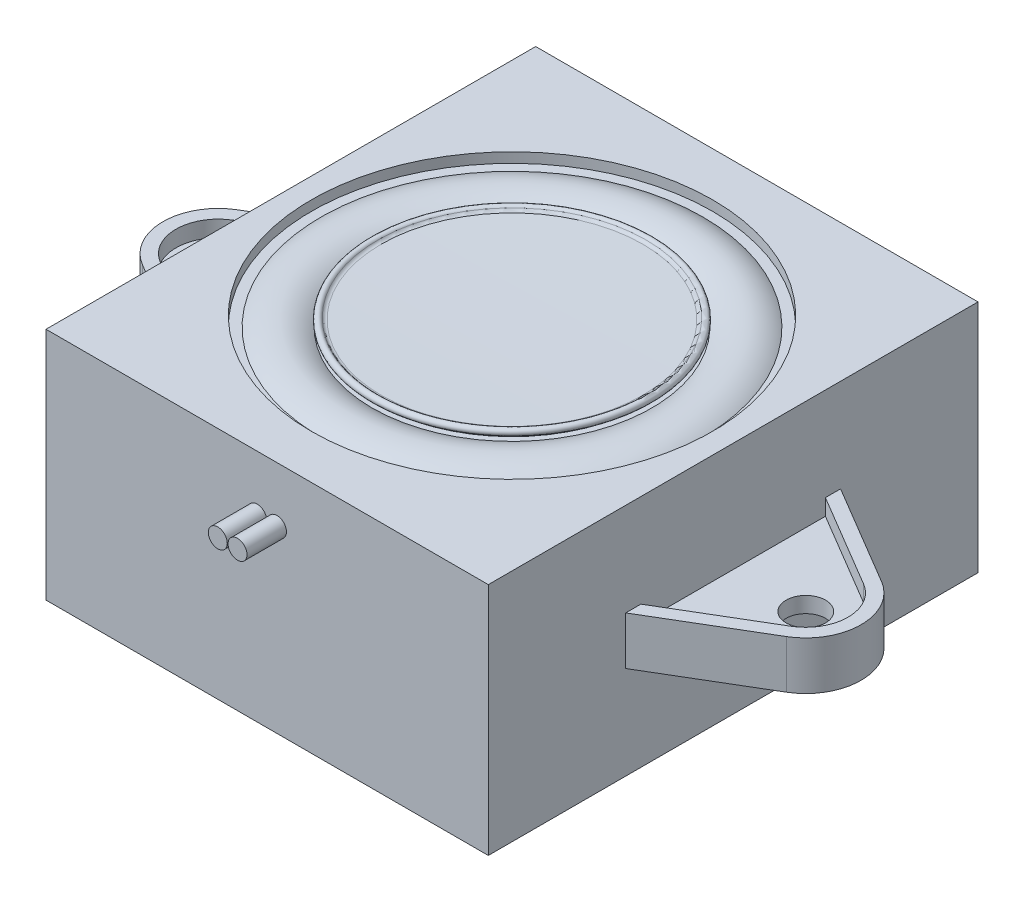
from build123d import *
from build123d.topology import SkipClean

# Parameters (mm, degrees)
SKETCH1_W           = 28
SKETCH1_H           = 31
BOSS_EXTRUDE1_DEPTH = 7.425
SKETCH2_R           = 1.25
BOSS_EXTRUDE2_DEPTH = 0.5
BOSS_EXTRUDE3_DEPTH = 1.525
SKETCH3_R           = 12.7
CUT_EXTRUDE1_DEPTH  = 0.635
SKETCH7_R           = 0.6
BOSS_EXTRUDE6_DEPTH = 2.5


with BuildPart() as part:
    # Sketch1 → Boss-Extrude1 (new, symmetric)
    with BuildSketch(Plane(origin=(0, 0, 0), x_dir=(1, 0, 0), z_dir=(0, 1, 0))):
        with Locations((14, 15.5)):
            Rectangle(SKETCH1_W, SKETCH1_H)
    extrude(amount=BOSS_EXTRUDE1_DEPTH, both=True)

    # Sketch2 → Boss-Extrude2 (add, symmetric)
    # profile 1 of 2: a face of its own
    with BuildSketch(Plane(origin=(0, 0, 0), x_dir=(1, 0, 0), z_dir=(0, 1, 0))):
        with BuildLine():
            Line((0, 8.7), (0, 22.3))
            Line((0, 22.3), (-6.386291535, 18.509844274))
            ThreePointArc((-6.386291535, 18.509844274), (-8.1, 15.5), (-6.386291535, 12.490155726))
            Line((-6.386291535, 12.490155726), (0, 8.7))
        make_face()
        with Locations((-4.6, 15.5)):
            Circle(SKETCH2_R, mode=Mode.SUBTRACT)
    # profile 2 of 2: a face of its own
    with BuildSketch(Plane(origin=(0, 0, 0), x_dir=(1, 0, 0), z_dir=(0, 1, 0))):
        with BuildLine():
            Line((34.386291535, 12.490155726), (28, 8.7))
            Line((28, 8.7), (28, 22.3))
            Line((28, 22.3), (34.386291535, 18.509844274))
            ThreePointArc((34.386291535, 18.509844274), (36.1, 15.5), (34.386291535, 12.490155726))
        make_face()
        with Locations((32.6, 15.5)):
            Circle(SKETCH2_R, mode=Mode.SUBTRACT)
    extrude(amount=BOSS_EXTRUDE2_DEPTH, both=True)

    # Sketch5 → Boss-Extrude3 (add, symmetric)
    with SkipClean():  # the faces are left unmerged after this step: merging them gives an invalid solid
        with BuildSketch(Plane(origin=(0, 0, 0), x_dir=(1, 0, 0), z_dir=(0, 1, 0))):
            with BuildLine():
                ThreePointArc((-6.386291535, 18.509844274), (-8.1, 15.5), (-6.386291535, 12.490155726))
                Line((-6.386291535, 12.490155726), (0, 8.7))
                Line((0, 8.7), (0, 9.659933384))
                Line((0, 9.659933384), (-5.964981917, 13.200048997))
                ThreePointArc((-5.964981917, 13.200048997), (-7.2745, 15.5), (-5.964981917, 17.799951003))
                Line((-5.964981917, 17.799951003), (0, 21.340066616))
                Line((0, 21.340066616), (0, 22.3))
                Line((0, 22.3), (-6.386291535, 18.509844274))
            make_face()
            with BuildLine():
                ThreePointArc((34.386291535, 12.490155726), (36.1, 15.5), (34.386291535, 18.509844274))
                Line((34.386291535, 18.509844274), (28, 22.3))
                Line((28, 22.3), (28, 21.340066616))
                Line((28, 21.340066616), (33.964981917, 17.799951003))
                ThreePointArc((33.964981917, 17.799951003), (35.2745, 15.5), (33.964981917, 13.200048997))
                Line((33.964981917, 13.200048997), (28, 9.659933384))
                Line((28, 9.659933384), (28, 8.7))
                Line((28, 8.7), (34.386291535, 12.490155726))
            make_face()
        extrude(amount=BOSS_EXTRUDE3_DEPTH, both=True)
    add(part.part.scale(1), mode=Mode.REPLACE)  # the faces are merged on a copy

    # Sketch3 → Cut-Extrude1 (cut)
    with BuildSketch(Plane(origin=(0, 7.425, 0), x_dir=(1, 0, 0), z_dir=(0, 1, 0))):
        with Locations((14, 15.5)):
            Circle(SKETCH3_R)
    extrude(amount=-CUT_EXTRUDE1_DEPTH, mode=Mode.SUBTRACT)

    # Sketch6 → Revolve1 (revolve)
    with BuildSketch(Plane(origin=(0, 0, -15.5), x_dir=(-1, 0, 0), z_dir=(0, 0, -1))):
        with BuildLine():
            Line((-22.493511176, 6.79), (-22.810948315, 7.046589007))
            ThreePointArc((-22.810948315, 7.046589007), (-22.816802833, 7.372772527), (-22.494598431, 7.321642421))
            ThreePointArc((-22.494598431, 7.321642421), (-22.403694623, 7.232370162), (-22.280839201, 7.198612444))
            ThreePointArc((-22.280839201, 7.198612444), (-18.140521992, 7.154934635), (-14, 7.140375125))
            Line((-14, 7.140375125), (-14, 6.79))
            Line((-14, 6.79), (-22.493511176, 6.79))
        make_face()
        with BuildLine():
            Line((-26.083336466, 6.79), (-22.86, 6.79))
            ThreePointArc((-22.86, 6.79), (-24.471668233, 7.315802401), (-26.083336466, 6.79))
        make_face()
    revolve(axis=Axis((14, -7.425, -15.5), (0, 1, 0)))

    # Sketch7 → Boss-Extrude6 (add)
    with BuildSketch(Plane.XY):
        with Locations((14.625, 3.925)):
            Circle(SKETCH7_R)
        with Locations((13.375, 3.925)):
            Circle(SKETCH7_R)
    extrude(amount=BOSS_EXTRUDE6_DEPTH)


solid = part.part
